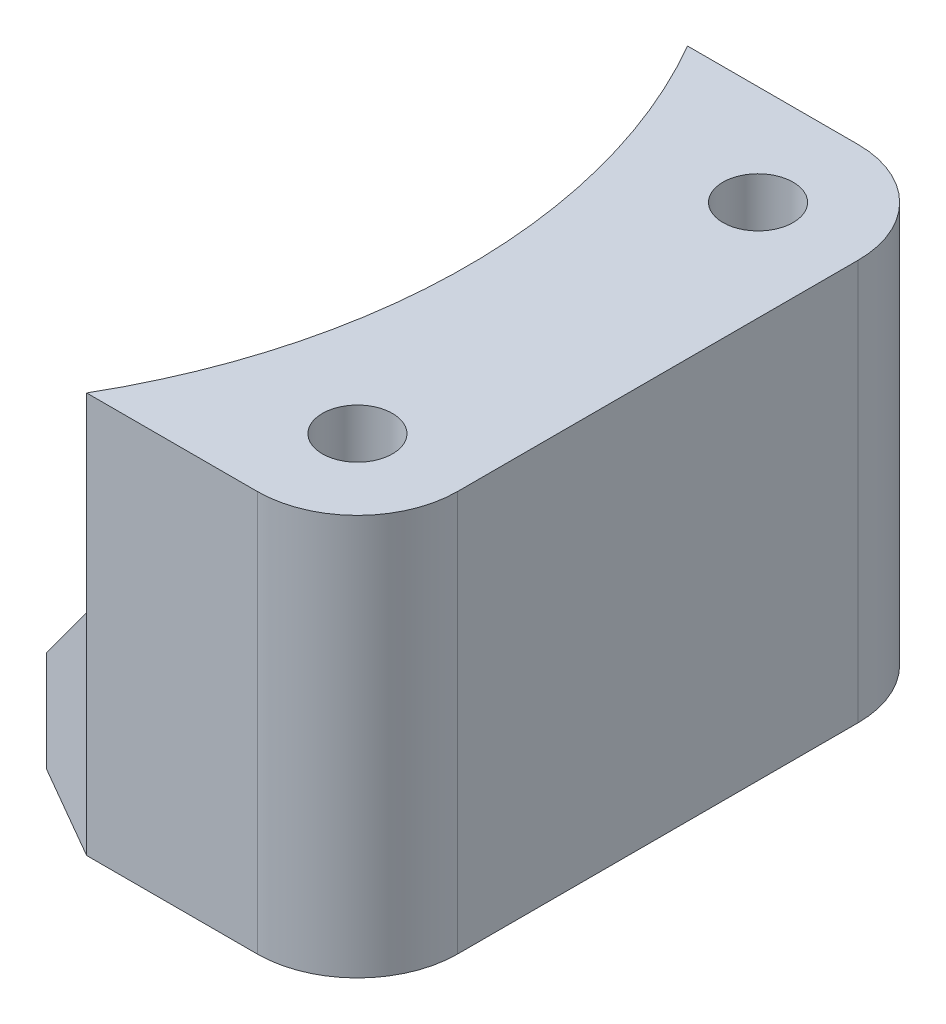
from build123d import *

# Parameters (mm, degrees)
REVOLVE1_ANGLE      = 60
SKETCH2_OUTSIDE_W   = 36.094
SKETCH2_OUTSIDE_H   = 57.312
SKETCH2_OUTSIDE_W_2 = 27.637577589
SKETCH2_OUTSIDE_H_2 = 30
CUT_EXTRUDE2_DEPTH  = 40
FILLET1_R           = 5
SKETCH3_R           = 1.75
CUT_EXTRUDE3_DEPTH  = 40


with BuildPart() as part:
    # Sketch1 → Revolve1 (revolve, symmetric)
    with BuildSketch(Plane.XY) as revolve1_sk:
        Polygon((30, 20), (30, 10.5), (24.5, 5), (24.5, 0), (44.5, 0), (44.5, 20), align=None)
    revolve(axis=Axis((0, 0, 0), (0, 1, 0)), revolution_arc=REVOLVE1_ANGLE / 2)
    revolve(revolve1_sk.sketch, axis=Axis((0, 0, 0), (0, -1, 0)), revolution_arc=REVOLVE1_ANGLE / 2)

    # Sketch2 outside → Cut-Extrude2 (cut)
    with BuildSketch(Plane(origin=(0, 0, 0), x_dir=(1, 0, 0), z_dir=(0, 1, 0))):
        with Locations((32.859, 0)):
            Rectangle(SKETCH2_OUTSIDE_W, SKETCH2_OUTSIDE_H)
        with Locations((25.681211205, 0)):
            Rectangle(SKETCH2_OUTSIDE_W_2, SKETCH2_OUTSIDE_H_2, mode=Mode.SUBTRACT)
    extrude(amount=CUT_EXTRUDE2_DEPTH, mode=Mode.SUBTRACT)

    # Fillet1
    fillet1_edges = [part.edges().sort_by_distance(p)[0] for p in [
        (39.5, 10, -15),
        (39.5, 10, 15),
    ]]
    fillet(fillet1_edges, radius=FILLET1_R)

    # Sketch3 → Cut-Extrude3 (cut)
    with BuildSketch(Plane(origin=(0, 20, 0), x_dir=(1, 0, 0), z_dir=(0, 1, 0))):
        with Locations((34.5, -10)):
            Circle(SKETCH3_R)
        with Locations((34.5, 10)):
            Circle(SKETCH3_R)
    extrude(amount=-CUT_EXTRUDE3_DEPTH, mode=Mode.SUBTRACT)


solid = part.part
